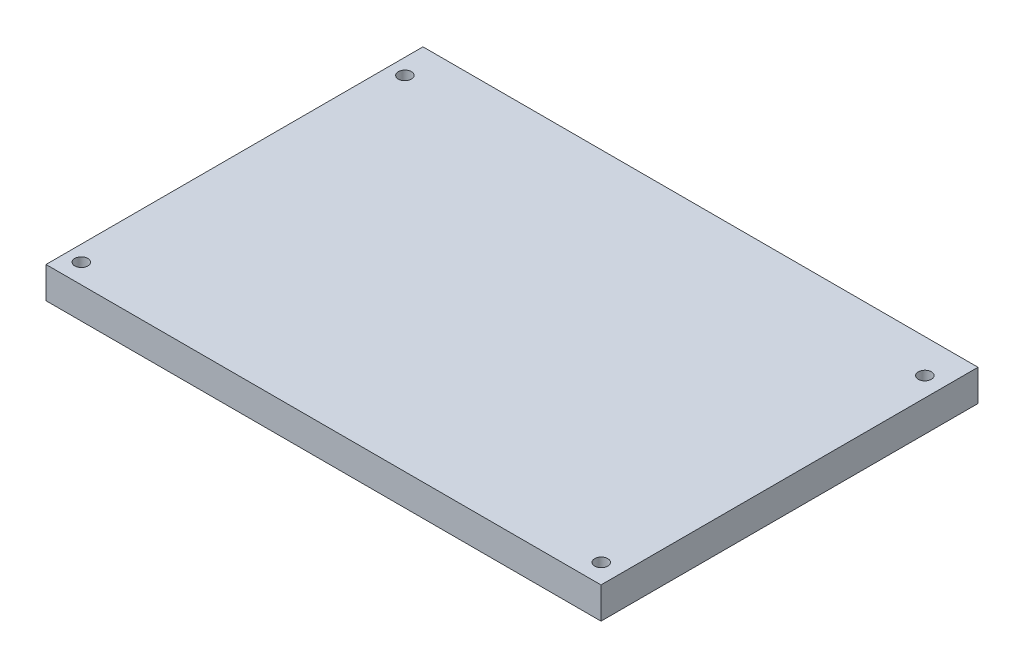
from build123d import *

# Parameters (mm, degrees)
SKETCH2_W           = 106
SKETCH2_H           = 6
BOSS_EXTRUDE1_DEPTH = 72
SKETCH4_R           = 1.25
CUT_EXTRUDE1_DEPTH  = 90.604687377
SKETCH5_R           = 1.75
CUT_EXTRUDE2_DEPTH  = 10


with BuildPart() as part:
    # Sketch2 → Boss-Extrude1 (new body)
    with BuildSketch(Plane.XY):
        Rectangle(SKETCH2_W, SKETCH2_H)
    extrude(amount=BOSS_EXTRUDE1_DEPTH)

    # Sketch4 → Cut-Extrude1 (cut, through all)
    with BuildSketch(Plane(origin=(0, 3, 0), x_dir=(1, 0, 0), z_dir=(0, 1, 0))):
        with Locations((-50.004878073, -68.250693227)):
            Circle(SKETCH4_R)
        with Locations((49.295121927, -68.250693227)):
            Circle(SKETCH4_R)
        with Locations((49.295121927, -6.450693227)):
            Circle(SKETCH4_R)
        with Locations((-50.004878073, -6.450693227)):
            Circle(SKETCH4_R)
    extrude(amount=-CUT_EXTRUDE1_DEPTH, mode=Mode.SUBTRACT)

    # Sketch5 → Cut-Extrude2 (cut)
    with BuildSketch(Plane(origin=(0, 0, 0), x_dir=(-1, 0, 0), z_dir=(0, 0, -1))):
        Circle(SKETCH5_R)
        with Locations((26.5, 0)):
            Circle(SKETCH5_R)
        with Locations((-26.5, 0)):
            Circle(SKETCH5_R)
    extrude(amount=-CUT_EXTRUDE2_DEPTH, mode=Mode.SUBTRACT)


solid = part.part
